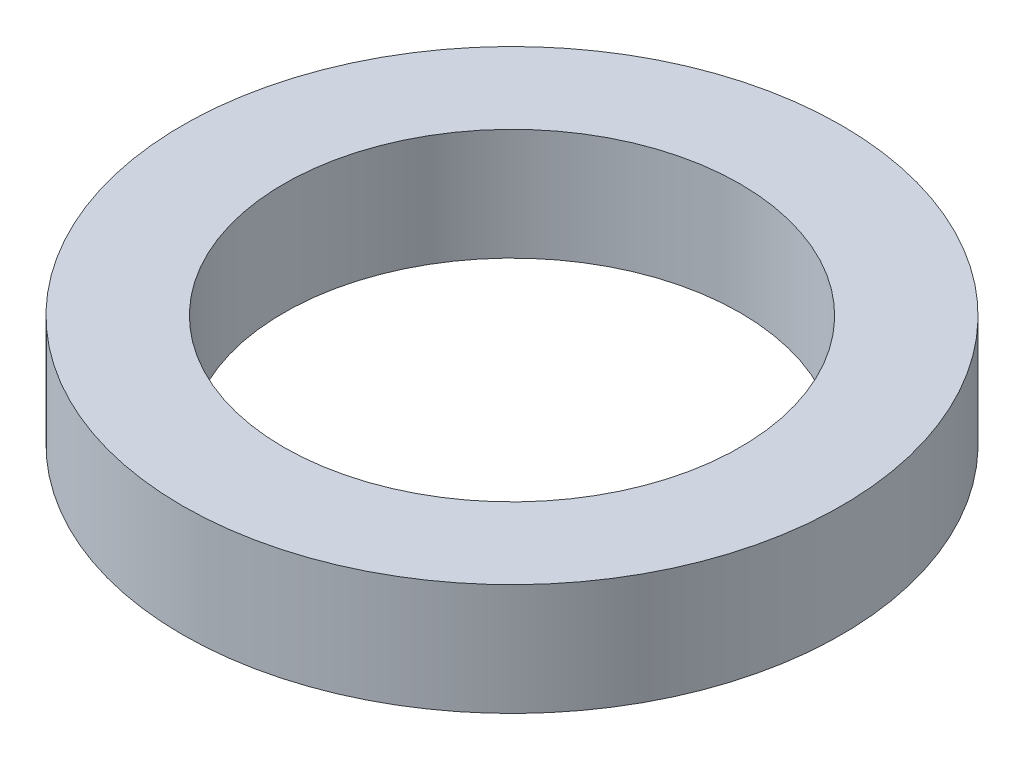
from build123d import *

# Parameters (mm, degrees)
SKETCH1_R           = 6.5
SKETCH1_R_2         = 4.5
BOSS_EXTRUDE1_DEPTH = 2.2


with BuildPart() as part:
    # Sketch1 → Boss-Extrude1 (new body)
    with BuildSketch(Plane(origin=(0, 0, 0), x_dir=(1, 0, 0), z_dir=(0, 1, 0))):
        Circle(SKETCH1_R)
        Circle(SKETCH1_R_2, mode=Mode.SUBTRACT)
    extrude(amount=BOSS_EXTRUDE1_DEPTH)


solid = part.part
